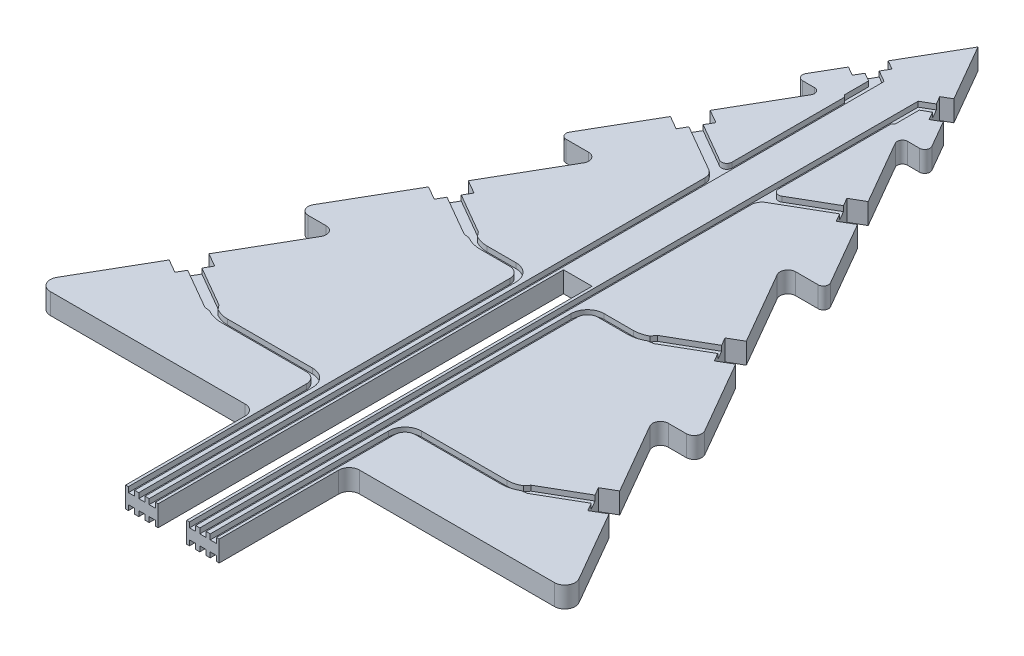
from build123d import *

# Parameters (mm, degrees)
ESBO_O1_W                       = 18
ESBO_O1_H                       = 25
RVORE_DEPTH                     = 4
FILETE2_R                       = 1
FILETE3_R                       = 1
FILETE4_R                       = 1
FILETE5_R                       = 1
FILETE6_R                       = 1
FILETE7_R                       = 1
FILETE8_R                       = 1.5
FILETE9_R                       = 1.5
FILETE10_R                      = 1.5
FILETE11_R                      = 1.5
FILETE12_R                      = 2
FILETE13_R                      = 2
FILETE14_R                      = 2
FILETE15_R                      = 2
FILETE16_R                      = 1.5
FILETE17_R                      = 1.5
CORTES_DO_LED_DEPTH             = 10
V_OS_DEPTH                      = 1
FILETE18_R                      = 2
FILETE19_R                      = 1
CHANFRO7_SIZE                   = 0.5
CORTE_EXTRUS_O1_START           = -1
CORTE_EXTRUS_O1_DEPTH           = 1
FILETE20_R                      = 1.5
FILETE21_R                      = 1.5
CHANFRO8_SIZE                   = 0.5
ESPELHAR_START                  = 3
ESPELHAR_V_OS_DA_FRENTE_DEPTH   = 1
ESPELHAR_V_OS_DA_TRASEIRA_DEPTH = 1
ESBO_O10_W                      = 5.5
ESBO_O10_H                      = 78
ENCAIXE_DEPTH                   = 149.882469386


# Read off the part's stored shape, not the designer's step: Espelhar Vãos da Frente, Espelhar Vãos da Traseira
with BuildPart() as part:
    # Esboço1 → rvore (new body)
    with BuildSketch(Plane(origin=(0, 0, 0), x_dir=(1, 0, 0), z_dir=(0, 1, 0))):
        with Locations((0, -127.5)):
            Rectangle(ESBO_O1_W, ESBO_O1_H)
        Polygon((-51.961524227, -115), (-9, -115), (9, -115), (51.961524227, -115), (30.310889132, -77.5), (-30.310889132, -77.5), align=None)
        Polygon((-8.660254038, -40), (-30.310889132, -77.5), (30.310889132, -77.5), (8.660254038, -40), align=None)
        Polygon((-17.320508076, -40), (-8.660254038, -40), (0, -25), (8.660254038, -40), (17.320508076, -40), (0, -10), align=None)
        Polygon((8.660254038, -40), (30.310889132, -77.5), (38.97114317, -77.5), (17.320508076, -40), align=None)
        Polygon((0, -25), (-8.660254038, -40), (8.660254038, -40), align=None)
        Polygon((-38.97114317, -77.5), (-30.310889132, -77.5), (-8.660254038, -40), (-17.320508076, -40), align=None)
        Polygon((-25.980762114, -40), (-17.320508076, -40), (0, -10), (17.320508076, -40), (25.980762114, -40), (7.216878365, -7.5), (-7.216878365, -7.5), align=None)
        Polygon((0, 5), (-7.216878365, -7.5), (7.216878365, -7.5), align=None)
        Polygon((-12.990381057, -7.5), (-7.216878365, -7.5), (0, 5), (7.216878365, -7.5), (12.990381057, -7.5), (0, 15), align=None)
    extrude(amount=RVORE_DEPTH)

    # Filete2
    filete2_edges = [part.edges().sort_by_distance(p)[0] for p in [
        (12.990381057, 2, 7.5),
    ]]
    fillet(filete2_edges, radius=FILETE2_R)

    # Filete3
    filete3_edges = [part.edges().sort_by_distance(p)[0] for p in [
        (-12.990381057, 2, 7.5),
    ]]
    fillet(filete3_edges, radius=FILETE3_R)

    # Filete4
    filete4_edges = [part.edges().sort_by_distance(p)[0] for p in [
        (-7.216878365, 2, 7.5),
    ]]
    fillet(filete4_edges, radius=FILETE4_R)

    # Filete5
    filete5_edges = [part.edges().sort_by_distance(p)[0] for p in [
        (7.216878365, 2, 7.5),
    ]]
    fillet(filete5_edges, radius=FILETE5_R)

    # Filete6
    filete6_edges = [part.edges().sort_by_distance(p)[0] for p in [
        (25.980762114, 2, 40),
    ]]
    fillet(filete6_edges, radius=FILETE6_R)

    # Filete7
    filete7_edges = [part.edges().sort_by_distance(p)[0] for p in [
        (-25.980762114, 2, 40),
    ]]
    fillet(filete7_edges, radius=FILETE7_R)

    # Filete8
    filete8_edges = [part.edges().sort_by_distance(p)[0] for p in [
        (17.320508076, 2, 40),
    ]]
    fillet(filete8_edges, radius=FILETE8_R)

    # Filete9
    filete9_edges = [part.edges().sort_by_distance(p)[0] for p in [
        (-17.320508076, 2, 40),
    ]]
    fillet(filete9_edges, radius=FILETE9_R)

    # Filete10
    filete10_edges = [part.edges().sort_by_distance(p)[0] for p in [
        (38.97114317, 2, 77.5),
    ]]
    fillet(filete10_edges, radius=FILETE10_R)

    # Filete11
    filete11_edges = [part.edges().sort_by_distance(p)[0] for p in [
        (-38.97114317, 2, 77.5),
    ]]
    fillet(filete11_edges, radius=FILETE11_R)

    # Filete12
    filete12_edges = [part.edges().sort_by_distance(p)[0] for p in [
        (51.961524227, 2, 115),
    ]]
    fillet(filete12_edges, radius=FILETE12_R)

    # Filete13
    filete13_edges = [part.edges().sort_by_distance(p)[0] for p in [
        (-51.961524227, 2, 115),
    ]]
    fillet(filete13_edges, radius=FILETE13_R)

    # Filete14
    filete14_edges = [part.edges().sort_by_distance(p)[0] for p in [
        (9, 2, 115),
    ]]
    fillet(filete14_edges, radius=FILETE14_R)

    # Filete15
    filete15_edges = [part.edges().sort_by_distance(p)[0] for p in [
        (-9, 2, 115),
    ]]
    fillet(filete15_edges, radius=FILETE15_R)

    # Filete16
    filete16_edges = [part.edges().sort_by_distance(p)[0] for p in [
        (30.310889132, 2, 77.5),
    ]]
    fillet(filete16_edges, radius=FILETE16_R)

    # Filete17
    filete17_edges = [part.edges().sort_by_distance(p)[0] for p in [
        (-30.310889132, 2, 77.5),
    ]]
    fillet(filete17_edges, radius=FILETE17_R)

    # Esboço5 → Cortes do Led (cut)
    with BuildSketch(Plane(origin=(0, 4, 0), x_dir=(1, 0, 0), z_dir=(0, 1, 0))):
        Polygon((42.319473419, -98.299478112), (39.519473419, -93.449735851), (36.921397208, -94.949735851), (39.721397208, -99.799478112), align=None)
        Polygon((29.544605065, -61.172757061), (26.744605065, -56.3230148), (24.146528853, -57.8230148), (26.946528853, -62.672757061), align=None)
        Polygon((17.99973671, -26.176458504), (15.19973671, -21.326716243), (12.601660498, -22.826716243), (15.401660498, -27.676458504), align=None)
        Polygon((9.124355653, -0.803847577), (6.324355653, 4.045894684), (4.592304845, 3.045894684), (7.392304845, -1.803847577), align=None)
        Polygon((-9.124355653, -0.803847577), (-6.324355653, 4.045894684), (-4.592304845, 3.045894684), (-7.392304845, -1.803847577), align=None)
        Polygon((-17.99973671, -26.176458504), (-15.19973671, -21.326716243), (-12.601660498, -22.826716243), (-15.401660498, -27.676458504), align=None)
        Polygon((-29.544605065, -61.172757061), (-26.744605065, -56.3230148), (-24.146528853, -57.8230148), (-26.946528853, -62.672757061), align=None)
        Polygon((-42.319473419, -98.299478112), (-39.519473419, -93.449735851), (-36.921397208, -94.949735851), (-39.721397208, -99.799478112), align=None)
    extrude(amount=-CORTES_DO_LED_DEPTH, mode=Mode.SUBTRACT)

    # Esboço6 → Vãos (cut)
    with BuildSketch(Plane(origin=(0, 4, 0), x_dir=(1, 0, 0), z_dir=(0, 1, 0))):
        Polygon((3.275, -140), (4.475, -140), (4.475, -31.906507915), (14.501660498, -26.117612777), (13.501660498, -24.38556197), (4.475, -29.597106838), (4.475, -5.716873023), (4.875, -5.716873023), (4.875, -1.178753238), (6.492304845, -0.24500185), (5.492304845, 1.487048957), (3.275, 0.206887408), align=None)
        with BuildLine():
            Line((5.275, -68.59814367), (5.275, -140))
            Line((5.275, -140), (6.475, -140))
            Line((6.475, -140), (6.475, -68.59814367))
            ThreePointArc((6.475, -68.59814367), (7.060786438, -67.183930107), (8.475, -66.59814367))
            Line((8.475, -66.59814367), (14.086274815, -66.59814367))
            ThreePointArc((14.086274815, -66.59814367), (15.690952895, -66.386883793), (17.186274815, -65.767501173))
            Line((17.186274815, -65.767501173), (18.252300219, -65.613911335))
            Line((18.252300219, -65.613911335), (26.046528853, -61.113911335))
            Line((26.046528853, -61.113911335), (25.046528853, -59.381860527))
            Line((25.046528853, -59.381860527), (17.252300219, -63.881860527))
            Line((17.252300219, -63.881860527), (16.586274815, -64.728270689))
            ThreePointArc((16.586274815, -64.728270689), (15.380370041, -65.227772801), (14.086274815, -65.39814367))
            Line((14.086274815, -65.39814367), (8.475, -65.39814367))
            ThreePointArc((8.475, -65.39814367), (6.2122583, -66.33540197), (5.275, -68.59814367))
        make_face()
        with BuildLine():
            Line((7.275, -105.724864812), (7.275, -140))
            Line((7.275, -140), (8.475000015, -140))
            Line((8.475000015, -140), (8.475000015, -105.724864812))
            ThreePointArc((8.475000015, -105.724864812), (9.060786384, -104.310651231), (10.47499994, -103.724864804))
            Line((10.47499994, -103.724864804), (26.861143115, -103.724864804))
            ThreePointArc((26.861143115, -103.724864804), (28.465821237, -103.513604922), (29.96114317, -102.894222224))
            Line((29.96114317, -102.894222224), (31.027168574, -102.740632385))
            Line((31.027168574, -102.740632385), (38.821397208, -98.240632385))
            Line((38.821397208, -98.240632385), (37.821397208, -96.508581578))
            Line((37.821397208, -96.508581578), (30.027168574, -101.008581578))
            Line((30.027168574, -101.008581578), (29.36114317, -101.854991739))
            ThreePointArc((29.36114317, -101.854991739), (28.155238386, -102.354493946), (26.861143115, -102.52486482))
            Line((26.861143115, -102.52486482), (10.47499994, -102.52486482))
            ThreePointArc((10.47499994, -102.52486482), (8.212258253, -103.46212311), (7.275, -105.724864812))
        make_face()
    extrude(amount=-V_OS_DEPTH, mode=Mode.SUBTRACT)

    # Filete18
    filete18_edges = [part.edges().sort_by_distance(p)[0] for p in [
        (4.475, 3.5, 31.906507915),
    ]]
    fillet(filete18_edges, radius=FILETE18_R)

    # Filete19
    filete19_edges = [part.edges().sort_by_distance(p)[0] for p in [
        (4.475, 3.5, 29.597106838),
    ]]
    fillet(filete19_edges, radius=FILETE19_R)

    # Chanfro7
    # the kernel refuses this chamfer: 0.5 mm, written as the material it takes off along each edge
    with BuildSketch(Plane(origin=(4.475, 5.285841494, 5.716873023), x_dir=(-0.027495876610585647, 0, 0.9996219169112968), z_dir=(0, -1, 0))) as chanfro7_piece_1_section:
        Polygon((CHANFRO7_SIZE * 0.999621916911, -CHANFRO7_SIZE * 0.0274958766106), (-CHANFRO7_SIZE * 0.0274958766106, -CHANFRO7_SIZE * 0.999621916911), (0, 0), align=None)
    chanfro7_piece_1 = extrude(amount=2.285841494, mode=Mode.PRIVATE)
    chanfro7_piece_1 = split(chanfro7_piece_1, bisect_by=Plane(origin=(4.875, 3.5, 5.889095245), z_dir=(-1, 0, 0)), keep=Keep.TOP, mode=Mode.PRIVATE)
    add(chanfro7_piece_1, mode=Mode.SUBTRACT)

    # Esboço7 → Corte-extrusão1 (cut)
    with BuildSketch(Plane.XZ.offset(CORTE_EXTRUS_O1_START)):
        Polygon((4.875, 1.178753238), (4.875, 5.716873023), (4.475, 5.716873023), (4.475, 140), (3.275, 140), (3.275, -0.206887408), (5.492304845, -1.487048957), (6.492304845, 0.24500185), align=None)
        with BuildLine():
            Line((6.475, 140), (5.275, 140))
            Line((5.275, 140), (5.275, 30.867277431))
            ThreePointArc((5.275, 30.867277431), (5.569744112, 29.767277431), (6.375, 28.962021542))
            Line((6.375, 28.962021542), (6.573457268, 28.38556197))
            Line((6.573457268, 28.38556197), (13.501660498, 24.38556197))
            Line((13.501660498, 24.38556197), (14.501660498, 26.117612777))
            Line((14.501660498, 26.117612777), (7.573457268, 30.117612777))
            Line((7.573457268, 30.117612777), (6.975, 30.001252027))
            ThreePointArc((6.975, 30.001252027), (6.608974596, 30.367277431), (6.475, 30.867277431))
            Line((6.475, 30.867277431), (6.475, 140))
        make_face()
        with BuildLine():
            Line((8.475, 140), (7.275, 140))
            Line((7.275, 140), (7.275, 68.59814367))
            ThreePointArc((7.275, 68.59814367), (8.193190015, 66.354632316), (10.420839495, 65.39860204))
            ThreePointArc((10.420839495, 65.39860204), (10.447866811, 65.418301754), (10.475, 65.437855388))
            Line((10.475, 65.437855388), (10.475, 65.39814367))
            Line((10.475, 65.39814367), (14.086274815, 65.39814367))
            ThreePointArc((14.086274815, 65.39814367), (15.380370041, 65.227772801), (16.586274815, 64.728270689))
            Line((16.586274815, 64.728270689), (17.252300219, 63.881860527))
            Line((17.252300219, 63.881860527), (25.046528853, 59.381860527))
            Line((25.046528853, 59.381860527), (26.046528853, 61.113911335))
            Line((26.046528853, 61.113911335), (18.252300219, 65.613911335))
            Line((18.252300219, 65.613911335), (17.186274815, 65.767501173))
            ThreePointArc((17.186274815, 65.767501173), (15.690952895, 66.386883793), (14.086274815, 66.59814367))
            Line((14.086274815, 66.59814367), (10.475, 66.59814367))
            ThreePointArc((10.475, 66.59814367), (9.060786438, 67.183930107), (8.475, 68.59814367))
            Line((8.475, 68.59814367), (8.475, 102.52486472))
            Line((8.475, 102.52486472), (26.86114317, 102.52486472))
            ThreePointArc((26.86114317, 102.52486472), (28.155238396, 102.354493852), (29.36114317, 101.854991739))
            Line((29.36114317, 101.854991739), (30.027168574, 101.008581578))
            Line((30.027168574, 101.008581578), (37.821397208, 96.508581578))
            Line((37.821397208, 96.508581578), (38.821397208, 98.240632385))
            Line((38.821397208, 98.240632385), (31.027168574, 102.740632385))
            Line((31.027168574, 102.740632385), (29.96114317, 102.894222224))
            ThreePointArc((29.96114317, 102.894222224), (28.46582125, 103.513604843), (26.86114317, 103.72486472))
            Line((26.86114317, 103.72486472), (8.475, 103.72486472))
            Line((8.475, 103.72486472), (8.475, 140))
        make_face()
    extrude(amount=CORTE_EXTRUS_O1_DEPTH, mode=Mode.SUBTRACT)

    # Filete20
    filete20_edges = [part.edges().sort_by_distance(p)[0] for p in [
        (8.475, 0.5, 102.52486472),
    ]]
    fillet(filete20_edges, radius=FILETE20_R)

    # Filete21
    filete21_edges = [part.edges().sort_by_distance(p)[0] for p in [
        (8.475, 0.5, 103.72486472),
    ]]
    fillet(filete21_edges, radius=FILETE21_R)

    # Chanfro8
    # the kernel refuses this chamfer: 0.5 mm, written as the material it takes off along each edge
    with BuildSketch(Plane(origin=(4.475, 1, 5.716873023), x_dir=(-0.027495876610585647, 0, 0.9996219169112968), z_dir=(0, -1, 0))) as chanfro8_piece_1_section:
        Polygon((CHANFRO8_SIZE * 0.999621916911, -CHANFRO8_SIZE * 0.0274958766106), (-CHANFRO8_SIZE * 0.0274958766106, -CHANFRO8_SIZE * 0.999621916911), (0, 0), align=None)
    chanfro8_piece_1 = extrude(amount=2.285841494, mode=Mode.PRIVATE)
    chanfro8_piece_1 = split(chanfro8_piece_1, bisect_by=Plane(origin=(4.875, 0.5, 5.889095245), z_dir=(-1, 0, 0)), keep=Keep.TOP, mode=Mode.PRIVATE)
    add(chanfro8_piece_1, mode=Mode.SUBTRACT)

    # Espelhar Vãos da Frente outline → Espelhar Vãos da Frente (cut)
    with BuildSketch(Plane(origin=(0, 0, 0), x_dir=(1, 0, 0), z_dir=(0, 1, 0)).offset(ESPELHAR_START)):
        with BuildLine():
            Line((-4.475, -6.216873023), (-4.475, -27.865056031))
            ThreePointArc((-4.475, -27.865056031), (-4.975, -28.731081435), (-5.975, -28.731081435))
            Line((-5.975, -28.731081435), (-13.501660498, -24.38556197))
            Line((-13.501660498, -24.38556197), (-14.501660498, -26.117612777))
            Line((-14.501660498, -26.117612777), (-5.475, -31.329157646))
            ThreePointArc((-5.475, -31.329157646), (-4.742949192, -32.061208454), (-4.475, -33.061208454))
            Line((-4.475, -33.061208454), (-4.475, -140))
            Line((-4.475, -140), (-3.275, -140))
            Line((-3.275, -140), (-3.275, 0.206887408))
            Line((-3.275, 0.206887408), (-5.492304845, 1.487048957))
            Line((-5.492304845, 1.487048957), (-6.492304845, -0.24500185))
            Line((-6.492304845, -0.24500185), (-4.875, -1.178753238))
            Line((-4.875, -1.178753238), (-4.875, -5.816873023))
            Line((-4.875, -5.816873023), (-4.475, -6.216873023))
        make_face()
        with BuildLine():
            Line((-8.475000015, -140), (-7.275, -140))
            Line((-7.275, -140), (-7.274999974, -105.724864812))
            ThreePointArc((-7.274999974, -105.724864812), (-8.212258264, -103.462123136), (-10.47499994, -102.524864846))
            Line((-10.47499994, -102.524864846), (-26.861143115, -102.524864778))
            ThreePointArc((-26.861143115, -102.524864778), (-28.15523838, -102.354493904), (-29.361143191, -101.854991776))
            Line((-29.361143191, -101.854991776), (-30.027168574, -101.008581578))
            Line((-30.027168574, -101.008581578), (-37.821397208, -96.508581578))
            Line((-37.821397208, -96.508581578), (-38.821397208, -98.240632385))
            Line((-38.821397208, -98.240632385), (-31.027168574, -102.740632385))
            Line((-31.027168574, -102.740632385), (-29.961143187, -102.894222253))
            ThreePointArc((-29.961143187, -102.894222253), (-28.465821232, -103.513604887), (-26.861143115, -103.724864769))
            Line((-26.861143115, -103.724864769), (-10.47499994, -103.724864845))
            ThreePointArc((-10.47499994, -103.724864845), (-9.060786401, -104.310651273), (-8.474999973, -105.724864812))
            Line((-8.474999973, -105.724864812), (-8.475000015, -140))
        make_face()
        with BuildLine():
            Line((-6.475, -140), (-5.275, -140))
            Line((-5.275, -140), (-5.275, -68.59814367))
            ThreePointArc((-5.275, -68.59814367), (-6.2122583, -66.33540197), (-8.475, -65.39814367))
            Line((-8.475, -65.39814367), (-14.086274815, -65.39814367))
            ThreePointArc((-14.086274815, -65.39814367), (-15.38037004, -65.227772801), (-16.586274815, -64.728270689))
            Line((-16.586274815, -64.728270689), (-17.252300219, -63.881860527))
            Line((-17.252300219, -63.881860527), (-25.046528853, -59.381860527))
            Line((-25.046528853, -59.381860527), (-26.046528853, -61.113911335))
            Line((-26.046528853, -61.113911335), (-18.252300219, -65.613911335))
            Line((-18.252300219, -65.613911335), (-17.186274815, -65.767501173))
            ThreePointArc((-17.186274815, -65.767501173), (-15.690952895, -66.386883793), (-14.086274815, -66.59814367))
            Line((-14.086274815, -66.59814367), (-8.475, -66.59814367))
            ThreePointArc((-8.475, -66.59814367), (-7.060786437, -67.183930108), (-6.475, -68.59814367))
            Line((-6.475, -68.59814367), (-6.475, -140))
        make_face()
    extrude(amount=ESPELHAR_V_OS_DA_FRENTE_DEPTH, mode=Mode.SUBTRACT)

    # Espelhar Vãos da Traseira outline → Espelhar Vãos da Traseira (cut)
    with BuildSketch(Plane(origin=(0, 0, 0), x_dir=(1, 0, 0), z_dir=(0, 1, 0))):
        with BuildLine():
            Line((-26.86114317, -103.72486472), (-9.975, -103.72486472))
            ThreePointArc((-9.975, -103.72486472), (-8.914339829, -104.164204549), (-8.475, -105.22486472))
            Line((-8.475, -105.22486472), (-8.475, -140))
            Line((-8.475, -140), (-7.275, -140))
            Line((-7.275, -140), (-7.275, -68.59814367))
            ThreePointArc((-7.275, -68.59814367), (-8.193190015, -66.354632316), (-10.420839495, -65.39860204))
            ThreePointArc((-10.420839495, -65.39860204), (-10.447866811, -65.418301754), (-10.475, -65.437855388))
            Line((-10.475, -65.437855388), (-10.475, -65.39814367))
            Line((-10.475, -65.39814367), (-14.086274815, -65.39814367))
            ThreePointArc((-14.086274815, -65.39814367), (-15.38037004, -65.227772801), (-16.586274815, -64.728270689))
            Line((-16.586274815, -64.728270689), (-17.252300219, -63.881860527))
            Line((-17.252300219, -63.881860527), (-25.046528853, -59.381860527))
            Line((-25.046528853, -59.381860527), (-26.046528853, -61.113911335))
            Line((-26.046528853, -61.113911335), (-18.252300219, -65.613911335))
            Line((-18.252300219, -65.613911335), (-17.186274815, -65.767501173))
            ThreePointArc((-17.186274815, -65.767501173), (-15.690952895, -66.386883793), (-14.086274815, -66.59814367))
            Line((-14.086274815, -66.59814367), (-10.475, -66.59814367))
            ThreePointArc((-10.475, -66.59814367), (-9.060786437, -67.183930107), (-8.475, -68.59814367))
            Line((-8.475, -68.59814367), (-8.475, -101.02486472))
            ThreePointArc((-8.475, -101.02486472), (-8.914339828, -102.085524892), (-9.975, -102.52486472))
            Line((-9.975, -102.52486472), (-26.86114317, -102.52486472))
            ThreePointArc((-26.86114317, -102.52486472), (-28.155238396, -102.354493852), (-29.36114317, -101.854991739))
            Line((-29.36114317, -101.854991739), (-30.027168574, -101.008581578))
            Line((-30.027168574, -101.008581578), (-37.821397208, -96.508581578))
            Line((-37.821397208, -96.508581578), (-38.821397208, -98.240632385))
            Line((-38.821397208, -98.240632385), (-31.027168574, -102.740632385))
            Line((-31.027168574, -102.740632385), (-29.96114317, -102.894222224))
            ThreePointArc((-29.96114317, -102.894222224), (-28.46582125, -103.513604843), (-26.86114317, -103.72486472))
        make_face()
        Polygon((-4.475, -6.216873023), (-4.475, -140), (-3.275, -140), (-3.275, 0.206887408), (-5.492304845, 1.487048957), (-6.492304845, -0.24500185), (-4.875, -1.178753238), (-4.875, -5.816873023), align=None)
        with BuildLine():
            Line((-6.475, -30.867277431), (-6.475, -140))
            Line((-6.475, -140), (-5.275, -140))
            Line((-5.275, -140), (-5.275, -30.867277431))
            ThreePointArc((-5.275, -30.867277431), (-5.569744112, -29.767277431), (-6.375, -28.962021542))
            Line((-6.375, -28.962021542), (-6.573457268, -28.38556197))
            Line((-6.573457268, -28.38556197), (-13.501660498, -24.38556197))
            Line((-13.501660498, -24.38556197), (-14.501660498, -26.117612777))
            Line((-14.501660498, -26.117612777), (-7.573457268, -30.117612777))
            Line((-7.573457268, -30.117612777), (-6.975, -30.001252027))
            ThreePointArc((-6.975, -30.001252027), (-6.608974596, -30.367277431), (-6.475, -30.867277431))
        make_face()
    extrude(amount=ESPELHAR_V_OS_DA_TRASEIRA_DEPTH, mode=Mode.SUBTRACT)

    # Esboço10 → Encaixe (cut, through all)
    with BuildSketch(Plane(origin=(0, 4, 0), x_dir=(1, 0, 0), z_dir=(0, 1, 0))):
        with Locations((0, -101)):
            Rectangle(ESBO_O10_W, ESBO_O10_H)
    extrude(amount=-ENCAIXE_DEPTH, mode=Mode.SUBTRACT)


solid = part.part
